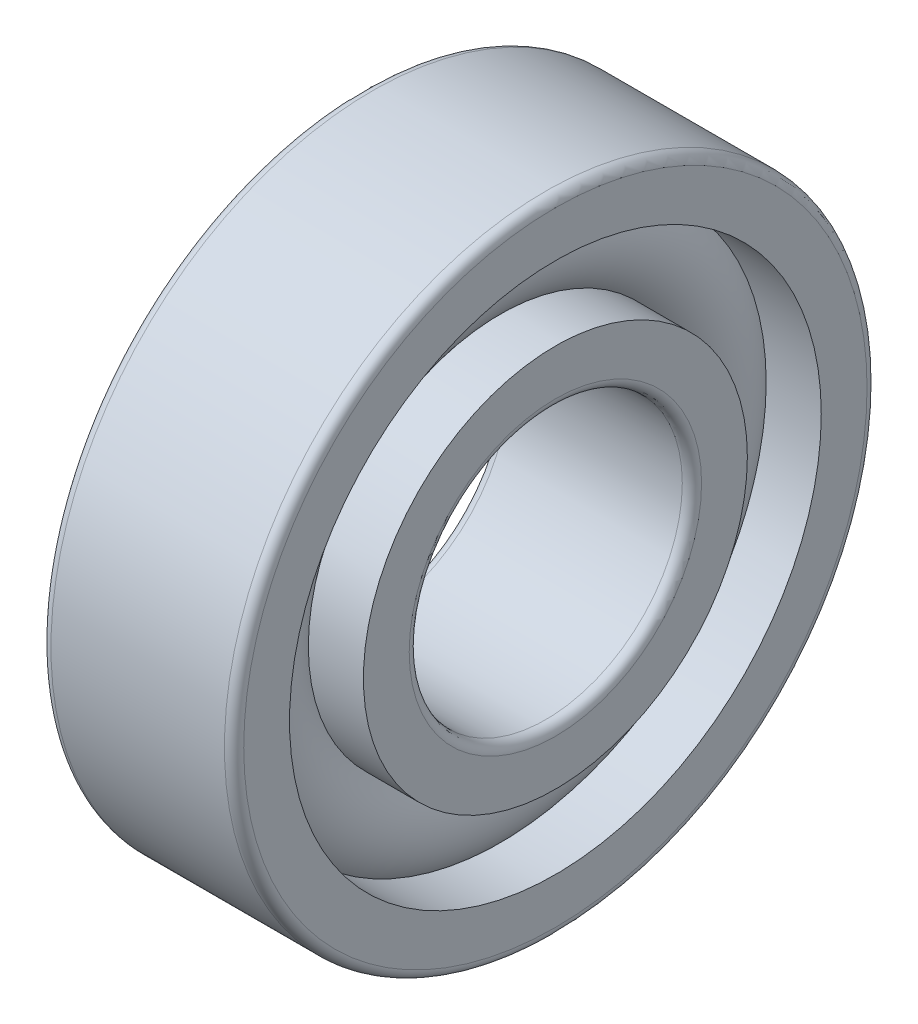
from build123d import *

# Parameters (mm, degrees)
CAGSPISKE_W     = 0.69
CAGSPISKE_H     = 1.15
CAGESPINE_ANGLE = 0.001
BALSIMSKE_R     = 3.45


with BuildPart() as part:
    # CagSpiSke → CageSpine (revolve)
    with BuildSketch(Plane.XY):
        with Locations((0, 14.25)):
            Rectangle(CAGSPISKE_W, CAGSPISKE_H)
    revolve(axis=Axis((-20.6375, 0, 0), (-1, 0, 0)), revolution_arc=CAGESPINE_ANGLE)

    # BalSimSke → BallsSimplified (revolve)
    with BuildSketch(Plane.XY):
        with Locations((0, 14.25)):
            Circle(BALSIMSKE_R)
    revolve(axis=Axis((-10, 0, 0), (1, 0, 0)))

    # InnRacSke → InnerRace (revolve)
    with BuildSketch(Plane.XY):
        with BuildLine():
            Line((-2.537838647, 11.95), (-6, 11.95))
            Line((-6, 11.95), (-6, 9.1))
            ThreePointArc((-6, 9.1), (-5.824264069, 8.675735931), (-5.4, 8.5))
            Line((-5.4, 8.5), (5.4, 8.5))
            ThreePointArc((5.4, 8.5), (5.824264069, 8.675735931), (6, 9.1))
            Line((6, 9.1), (6, 11.95))
            Line((6, 11.95), (2.537838647, 11.95))
            ThreePointArc((2.537838647, 11.95), (0, 10.825), (-2.537838647, 11.95))
        make_face()
    revolve(axis=Axis((-20.6375, 0, 0), (1, 0, 0)))

    # OutRacSke → OuterRace (revolve)
    with BuildSketch(Plane.XY):
        with BuildLine():
            Line((-2.537838647, 16.55), (-6, 16.55))
            Line((-6, 16.55), (-6, 19.4))
            ThreePointArc((-6, 19.4), (-5.824264069, 19.824264069), (-5.4, 20))
            Line((-5.4, 20), (5.4, 20))
            ThreePointArc((5.4, 20), (5.824264069, 19.824264069), (6, 19.4))
            Line((6, 19.4), (6, 16.55))
            Line((6, 16.55), (2.537838647, 16.55))
            ThreePointArc((2.537838647, 16.55), (0, 17.675), (-2.537838647, 16.55))
        make_face()
    revolve(axis=Axis((-20.6375, 0, 0), (1, 0, 0)))


solid = part.part
